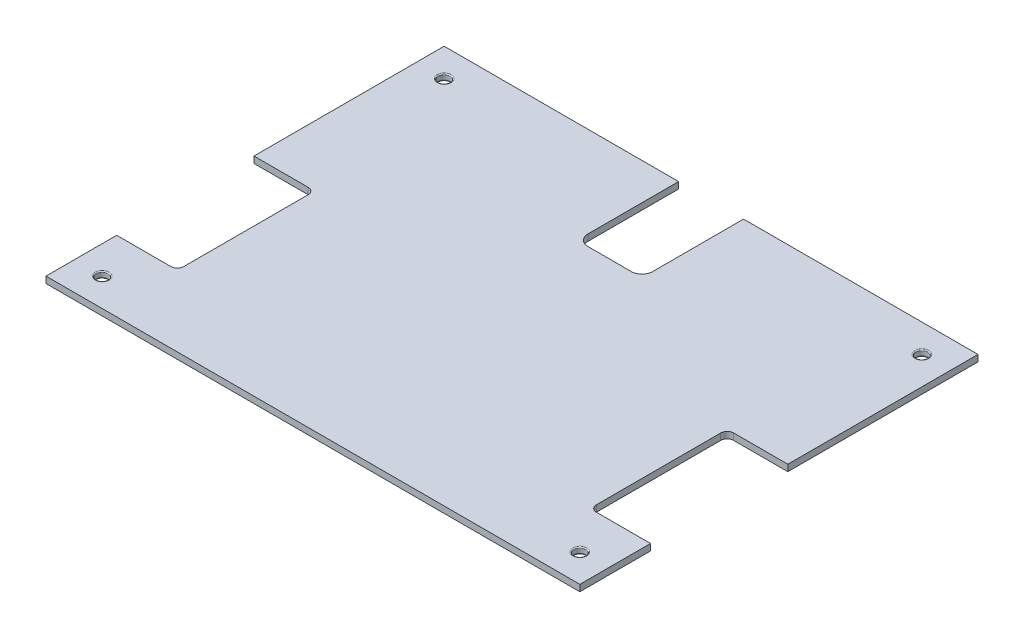
from build123d import *

# Parameters (mm, degrees)
SKETCH1_W           = 247.3
SKETCH1_H           = 184.45
BOSS_EXTRUDE1_DEPTH = 3
SKETCH2_R           = 2.75
CUT_EXTRUDE1_DEPTH  = 155.284714489
FILLET1_R           = 0.5
CUT_EXTRUDE3_DEPTH  = 155.284714489
CUT_EXTRUDE4_DEPTH  = 155.284714489


with BuildPart() as part:
    # Sketch1 → Boss-Extrude1 (new body)
    with BuildSketch(Plane(origin=(0, 0, 0), x_dir=(1, 0, 0), z_dir=(0, 1, 0))):
        Rectangle(SKETCH1_W, SKETCH1_H)
    extrude(amount=BOSS_EXTRUDE1_DEPTH)

    # Sketch2 → Cut-Extrude1 (cut, through all)
    with BuildSketch(Plane(origin=(0, 3, 0), x_dir=(1, 0, 0), z_dir=(0, 1, 0))):
        with Locations((-110.65, 79.225)):
            Circle(SKETCH2_R)
        with Locations((110.65, 79.225)):
            Circle(SKETCH2_R)
        with Locations((110.65, -79.225)):
            Circle(SKETCH2_R)
        with Locations((-110.65, -79.225)):
            Circle(SKETCH2_R)
    extrude(amount=-CUT_EXTRUDE1_DEPTH, mode=Mode.SUBTRACT)

    # Fillet1
    fillet1_edges = [part.edges().sort_by_distance(p)[0] for p in [
        (-113.4, 3, -79.225),
        (-113.4, 0, -79.225),
        (107.9, 3, -79.225),
        (107.9, 0, -79.225),
        (107.9, 3, 79.225),
        (107.9, 0, 79.225),
        (-113.4, 3, 79.225),
        (-113.4, 0, 79.225),
    ]]
    fillet(fillet1_edges, radius=FILLET1_R)

    # Sketch5 → Cut-Extrude3 (cut, through all)
    with BuildSketch(Plane(origin=(0, 3, 0), x_dir=(1, 0, 0), z_dir=(0, 1, 0))):
        with BuildLine():
            Line((-15.05, 92.225), (15.05, 92.225))
            Line((15.05, 92.225), (15.05, 50.175))
            ThreePointArc((15.05, 50.175), (13.585533906, 46.639466094), (10.05, 45.175))
            Line((10.05, 45.175), (-10.05, 45.175))
            ThreePointArc((-10.05, 45.175), (-13.585533906, 46.639466094), (-15.05, 50.175))
            Line((-15.05, 50.175), (-15.05, 92.225))
        make_face()
    extrude(amount=-CUT_EXTRUDE3_DEPTH, mode=Mode.SUBTRACT)

    # Sketch6 → Cut-Extrude4 (cut, through all)
    with BuildSketch(Plane(origin=(0, 3, 0), x_dir=(1, 0, 0), z_dir=(0, 1, 0))):
        with BuildLine():
            Line((-123.65, -59.475), (-98.57, -59.475))
            ThreePointArc((-98.57, -59.475), (-96.448679656, -58.596320344), (-95.57, -56.475))
            Line((-95.57, -56.475), (-95.57, 1.125))
            ThreePointArc((-95.57, 1.125), (-96.448679656, 3.246320344), (-98.57, 4.125))
            Line((-98.57, 4.125), (-123.65, 4.125))
            Line((-123.65, 4.125), (-123.65, -59.475))
        make_face()
        with BuildLine():
            Line((95.57, -56.475), (95.57, 1.125))
            ThreePointArc((95.57, 1.125), (96.448679656, 3.246320344), (98.57, 4.125))
            Line((98.57, 4.125), (123.65, 4.125))
            Line((123.65, 4.125), (123.65, -59.475))
            Line((123.65, -59.475), (98.57, -59.475))
            ThreePointArc((98.57, -59.475), (96.448679656, -58.596320344), (95.57, -56.475))
        make_face()
    extrude(amount=-CUT_EXTRUDE4_DEPTH, mode=Mode.SUBTRACT)


solid = part.part
